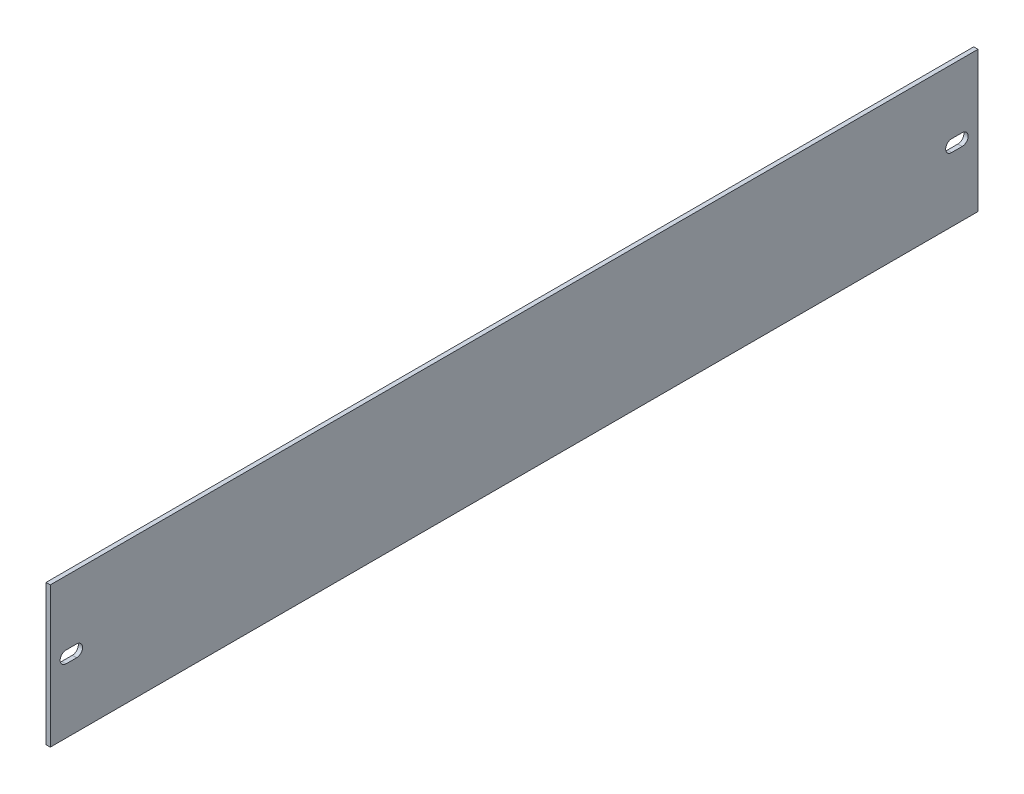
from build123d import *

# Parameters (mm, degrees)
SKETCH1_W                = 660
SKETCH1_H                = 100
BASE_FLANGE1_DEPTH       = 3.03784
M6_START                 = -3.03784
M6_CLEARANCE_SLOT1_DEPTH = 3.03784


# Read off the part's stored shape, not the designer's step: M6 Clearance Slot1
# Sheet-metal steps are written as plain solids
with BuildPart() as part:
    # Sketch1 → Base-Flange1 (new body)
    with BuildSketch(Plane(origin=(0, 0, 0), x_dir=(0, 0, -1), z_dir=(1, 0, 0))):
        with Locations((0, 50)):
            Rectangle(SKETCH1_W, SKETCH1_H)
    extrude(amount=-BASE_FLANGE1_DEPTH)

    # M6 Clearance Slot1 outline → M6 Clearance Slot1 (cut)
    with BuildSketch(Plane.YZ.offset(M6_START)):
        with BuildLine():
            Line((54.25, -318.75), (54.25, -311.25))
            ThreePointArc((54.25, -311.25), (50, -307), (45.75, -311.25))
            Line((45.75, -311.25), (45.75, -318.75))
            ThreePointArc((45.75, -318.75), (50, -323), (54.25, -318.75))
        make_face()
        with BuildLine():
            ThreePointArc((54.25, 318.75), (50, 323), (45.75, 318.75))
            Line((45.75, 318.75), (45.75, 311.25))
            ThreePointArc((45.75, 311.25), (50, 307), (54.25, 311.25))
            Line((54.25, 311.25), (54.25, 318.75))
        make_face()
    extrude(amount=M6_CLEARANCE_SLOT1_DEPTH, mode=Mode.SUBTRACT)


solid = part.part
